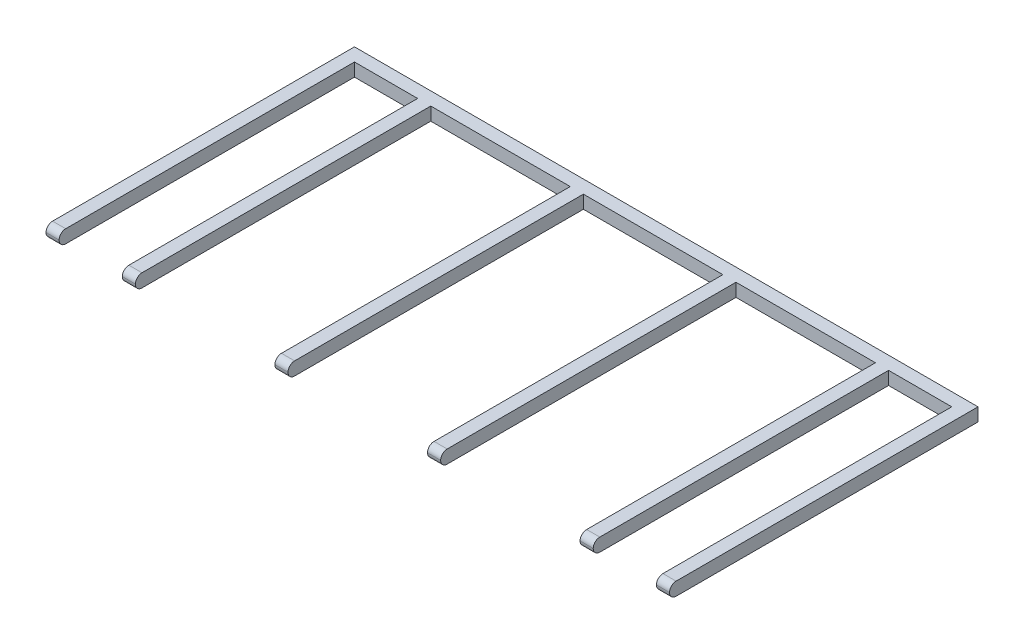
from build123d import *

# Parameters (mm, degrees)
SKETCH1_W              = 5.08
SKETCH1_H              = 5.08
BOSS_EXTRUDE1_DEPTH    = 241.3
SKETCH2_W              = 5.08
SKETCH2_H              = 5.08
BOSS_EXTRUDE2_DEPTH    = 116.84
FILLET1_R              = 2.54
LPATTERN1_COUNT        = 9
LPATTERN1_PITCH        = 29.5275
FILLET1_OF_LPATTERN1_R = 2.54


with BuildPart() as part:
    # Sketch1 → Boss-Extrude1 (new body)
    with BuildSketch(Plane(origin=(0, 0, 0), x_dir=(0, 0, -1), z_dir=(1, 0, 0))):
        Rectangle(SKETCH1_W, SKETCH1_H)
    extrude(amount=BOSS_EXTRUDE1_DEPTH)

    # Sketch2 → Boss-Extrude2 (add)
    with BuildSketch(Plane.XY):
        with Locations((2.54, 0)):
            Rectangle(SKETCH2_W, SKETCH2_H)
    boss_extrude2 = extrude(amount=BOSS_EXTRUDE2_DEPTH)

    # Fillet1
    fillet1_edges = [part.edges().sort_by_distance(p)[0] for p in [
        (2.54, -2.54, 116.84),
        (2.54, 2.54, 116.84),
    ]]
    fillet(fillet1_edges, radius=FILLET1_R - 0.0001)  # a hair under: the kernel refuses the full size

    # LPattern1: Boss-Extrude2 ×9, 3 skipped
    with Locations(*[(i * LPATTERN1_PITCH, 0, 0) for i in range(1, LPATTERN1_COUNT) if i not in (2, 4, 6)]):
        add(boss_extrude2)

    # Fillet1 of LPattern1
    fillet1_of_lpattern1_edges = [part.edges().sort_by_distance(p)[0] for p in [
        (32.0675, -2.54, 116.84),
        (32.0675, 2.54, 116.84),
        (91.1225, -2.54, 116.84),
        (91.1225, 2.54, 116.84),
        (150.1775, -2.54, 116.84),
        (150.1775, 2.54, 116.84),
        (209.2325, -2.54, 116.84),
        (209.2325, 2.54, 116.84),
        (238.76, -2.54, 116.84),
        (238.76, 2.54, 116.84),
    ]]
    fillet(fillet1_of_lpattern1_edges, radius=FILLET1_OF_LPATTERN1_R - 0.0001)  # a hair under: the kernel refuses the full size


solid = part.part
